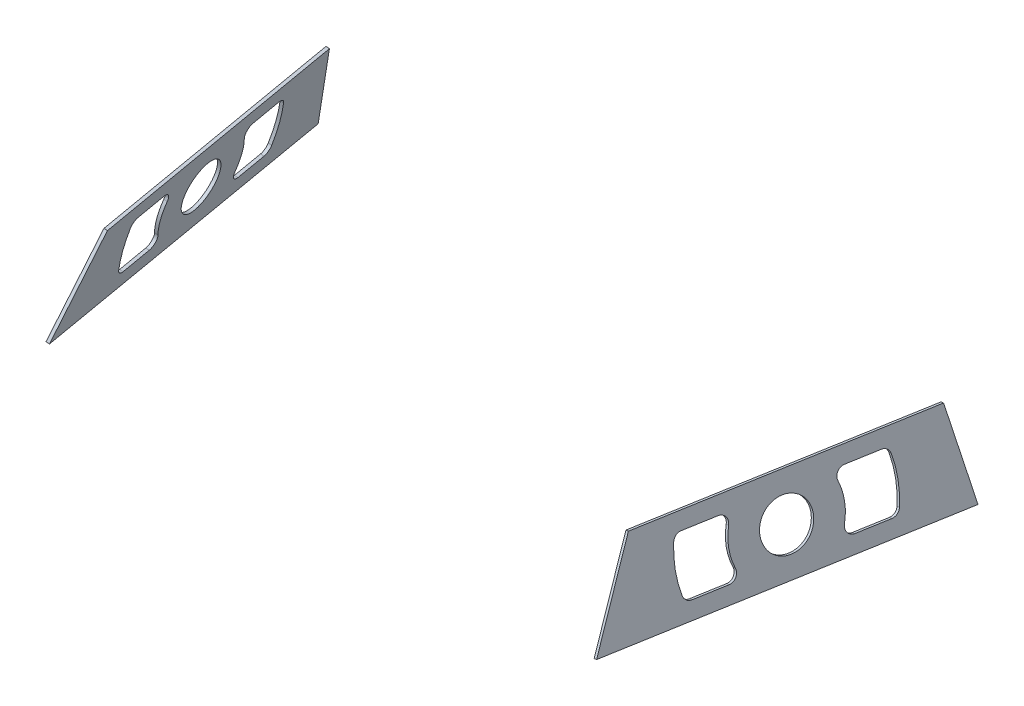
from build123d import *

# Parameters (mm, degrees)
BOSS_EXTRUDE1_DEPTH     = 2
SKETCH3_R               = 15
CUT_EXTRUDE4_DEPTH      = 2
CUT_EXTRUDE5_DEPTH      = 1810.90684447
CUT_EXTRUDE5_DEPTH_BACK = 1810.90684447


with BuildPart() as part:
    # Sketch1 → Boss-Extrude1 (new body)
    with BuildSketch(Plane(origin=(-623.125546732, 157.915886952, 108.061795504), x_dir=(0.16069859429951294, -0.040725117408276085, 0.9861629817642938), z_dir=(-0.9559431723322133, 0.2422603514272762, 0.16577868800831222))):
        Polygon((1410.851751679, 806.085490904), (1403.247038481, 750.717480033), (1617.041928079, 759.699545985), (1587.519771299, 813.507762816), align=None)
    extrude(amount=BOSS_EXTRUDE1_DEPTH)

    # Sketch3 → Cut-Extrude4 (cut)
    with BuildSketch(Plane(origin=(-623.125546732, 157.915886952, 108.061795504), x_dir=(0.16069859429951294, -0.040725117408276085, 0.9861629817642938), z_dir=(-0.9559431723322133, 0.2422603514272762, 0.16577868800831222))):
        with Locations((1504.665122385, 782.502569935)):
            Circle(SKETCH3_R)
    extrude(amount=CUT_EXTRUDE4_DEPTH, mode=Mode.SUBTRACT)

    # Sketch4 → Cut-Extrude5 (cut, two sides: drawn at the far end of the back side and taken through both)
    with BuildSketch(Plane(origin=(-625.037433077, 158.400407655, 108.39335288), x_dir=(0.16069859429951333, -0.040725117408276126, 0.9861629817642937), z_dir=(-0.9559431723322133, 0.24226035142727567, 0.1657786880083126)).offset(-CUT_EXTRUDE5_DEPTH_BACK)):
        with BuildLine():
            Line((1468.557021503, 798.501014377), (1447.825224694, 797.630018973))
            ThreePointArc((1447.825224694, 797.630018973), (1444.741380815, 796.396260319), (1443.111023724, 793.502441174))
            ThreePointArc((1443.111023724, 793.502441174), (1442.224308734, 779.862256181), (1444.324068249, 766.35552008))
            ThreePointArc((1444.324068249, 766.35552008), (1446.195264272, 763.626515356), (1449.360980756, 762.663665167))
            Line((1449.360980756, 762.663665167), (1470.131910222, 763.536304634))
            ThreePointArc((1470.131910222, 763.536304634), (1474.127827634, 765.827958348), (1474.554029011, 770.414611278))
            ThreePointArc((1474.554029011, 770.414611278), (1472.196715805, 781.150588419), (1473.552913208, 792.05833151))
            ThreePointArc((1473.552913208, 792.05833151), (1472.718139009, 796.569357014), (1468.557021503, 798.501014377))
        make_face()
        with BuildLine():
            Line((1539.310411671, 801.47354388), (1560.042208481, 802.344539284))
            ThreePointArc((1560.042208481, 802.344539284), (1563.218669253, 801.373791918), (1565.086006101, 798.626919773))
            ThreePointArc((1565.086006101, 798.626919773), (1567.113694598, 785.109176267), (1566.154239292, 771.473914787))
            ThreePointArc((1566.154239292, 771.473914787), (1564.51853796, 768.597576404), (1561.444738115, 767.372588298))
            Line((1561.444738115, 767.372588298), (1540.67380865, 766.499948832))
            ThreePointArc((1540.67380865, 766.499948832), (1536.499755294, 768.448361337), (1535.690340982, 772.983102916))
            ThreePointArc((1535.690340982, 772.983102916), (1537.138845419, 783.878972116), (1534.87251802, 794.634523745))
            ThreePointArc((1534.87251802, 794.634523745), (1535.325979153, 799.199671286), (1539.310411671, 801.47354388))
        make_face()
    extrude(amount=CUT_EXTRUDE5_DEPTH + CUT_EXTRUDE5_DEPTH_BACK, mode=Mode.SUBTRACT)


with BuildPart() as body_2:
    # Mirror2: mirrored copy
    add(part.part.mirror(Plane(origin=(0, 0, 0), x_dir=(0, 0, 1), z_dir=(1, 0, 0))))


solid = Compound([part.part, body_2.part])
